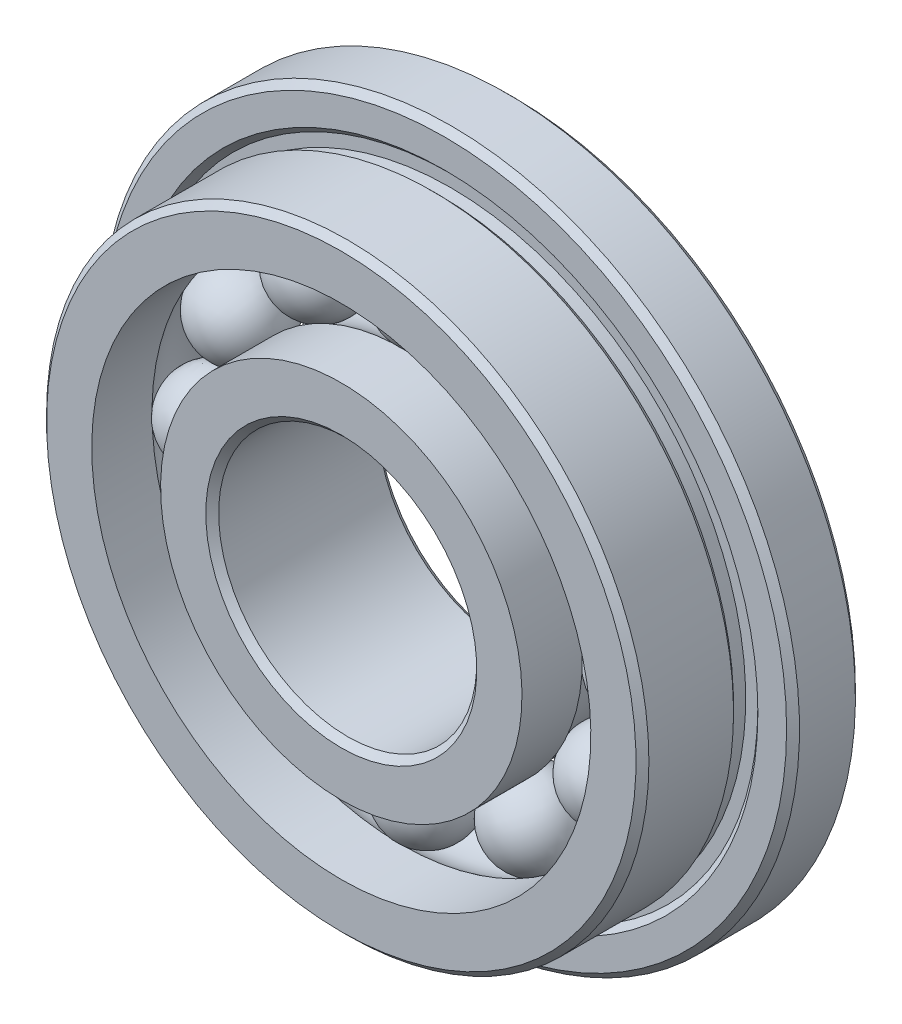
from build123d import *

# Parameters (mm, degrees)
FILLET1_SIZE      = 0.075
FILLET2_SIZE      = 0.075
CIRPATTERN3_COUNT = 12


with BuildPart() as part:
    # Sketch2 → Revolve1 (revolve)
    with BuildSketch(Plane(origin=(0, 0, 0), x_dir=(0, 0, -1), z_dir=(1, 0, 0))):
        with BuildLine():
            Line((1, 4.05), (0.2, 4.05))
            Line((0.2, 4.05), (0.2, 3.641421356))
            Line((0.2, 3.641421356), (0.270710678, 3.570710678))
            Line((0.270710678, 3.570710678), (0.270710678, 3.429289322))
            Line((0.270710678, 3.429289322), (0.129289322, 3.429289322))
            Line((0.129289322, 3.429289322), (0.058578644, 3.5))
            Line((0.058578644, 3.5), (-1, 3.5))
            Line((-1, 3.5), (-1, 2.9))
            Line((-1, 2.9), (-0.3, 2.9))
            ThreePointArc((-0.3, 2.9), (0, 3), (0.3, 2.9))
            Line((0.3, 2.9), (1, 2.9))
            Line((1, 2.9), (1, 4.05))
        make_face()
        with BuildLine():
            Line((1, 1.5), (-1, 1.5))
            Line((-1, 1.5), (-1, 2.1))
            Line((-1, 2.1), (-0.3, 2.1))
            ThreePointArc((-0.3, 2.1), (0, 2), (0.3, 2.1))
            Line((0.3, 2.1), (1, 2.1))
            Line((1, 2.1), (1, 1.5))
        make_face()
    revolve(axis=Axis((0, 0, 0), (0, 0, -1)))

    # Fillet1
    fillet1_edges = [part.edges().sort_by_distance(p)[0] for p in [
        (0, -4.05, -1),
        (0, -4.05, -0.2),
        (0, -3.5, 1),
    ]]
    chamfer(fillet1_edges, length=FILLET1_SIZE)

    # Fillet2
    fillet2_edges = [part.edges().sort_by_distance(p)[0] for p in [
        (0, -1.5, -1),
        (0, -1.5, 1),
    ]]
    chamfer(fillet2_edges, length=FILLET2_SIZE)


with BuildPart() as body_2:
    # Sketch7 → Revolve3 (revolve)
    with BuildSketch(Plane.XY):
        with BuildLine():
            Line((0, 3), (0, 2))
            ThreePointArc((0, 2), (-0.5, 2.5), (0, 3))
        make_face()
    revolve(axis=Axis((0, 3, 0), (0, -1, 0)))


with BuildPart() as cirpattern3_1:
    # CirPattern3: pattern copy
    add(body_2.part.rotate(Axis((0, 0, 0), (0, 0, -1)), 1 * 360 / CIRPATTERN3_COUNT))


with BuildPart() as cirpattern3_2:
    # CirPattern3: pattern copy
    add(body_2.part.rotate(Axis((0, 0, 0), (0, 0, -1)), 2 * 360 / CIRPATTERN3_COUNT))


with BuildPart() as cirpattern3_3:
    # CirPattern3: pattern copy
    add(body_2.part.rotate(Axis((0, 0, 0), (0, 0, -1)), 3 * 360 / CIRPATTERN3_COUNT))


with BuildPart() as cirpattern3_4:
    # CirPattern3: pattern copy
    add(body_2.part.rotate(Axis((0, 0, 0), (0, 0, -1)), 4 * 360 / CIRPATTERN3_COUNT))


with BuildPart() as cirpattern3_5:
    # CirPattern3: pattern copy
    add(body_2.part.rotate(Axis((0, 0, 0), (0, 0, -1)), 5 * 360 / CIRPATTERN3_COUNT))


with BuildPart() as cirpattern3_6:
    # CirPattern3: pattern copy
    add(body_2.part.rotate(Axis((0, 0, 0), (0, 0, -1)), 6 * 360 / CIRPATTERN3_COUNT))


with BuildPart() as cirpattern3_7:
    # CirPattern3: pattern copy
    add(body_2.part.rotate(Axis((0, 0, 0), (0, 0, -1)), 7 * 360 / CIRPATTERN3_COUNT))


with BuildPart() as cirpattern3_8:
    # CirPattern3: pattern copy
    add(body_2.part.rotate(Axis((0, 0, 0), (0, 0, -1)), 8 * 360 / CIRPATTERN3_COUNT))


with BuildPart() as cirpattern3_9:
    # CirPattern3: pattern copy
    add(body_2.part.rotate(Axis((0, 0, 0), (0, 0, -1)), 9 * 360 / CIRPATTERN3_COUNT))


with BuildPart() as cirpattern3_10:
    # CirPattern3: pattern copy
    add(body_2.part.rotate(Axis((0, 0, 0), (0, 0, -1)), 10 * 360 / CIRPATTERN3_COUNT))


with BuildPart() as cirpattern3_11:
    # CirPattern3: pattern copy
    add(body_2.part.rotate(Axis((0, 0, 0), (0, 0, -1)), 11 * 360 / CIRPATTERN3_COUNT))


solid = Compound([part.part, body_2.part, cirpattern3_1.part, cirpattern3_2.part, cirpattern3_3.part, cirpattern3_4.part, cirpattern3_5.part, cirpattern3_6.part, cirpattern3_7.part, cirpattern3_8.part, cirpattern3_9.part, cirpattern3_10.part, cirpattern3_11.part])
